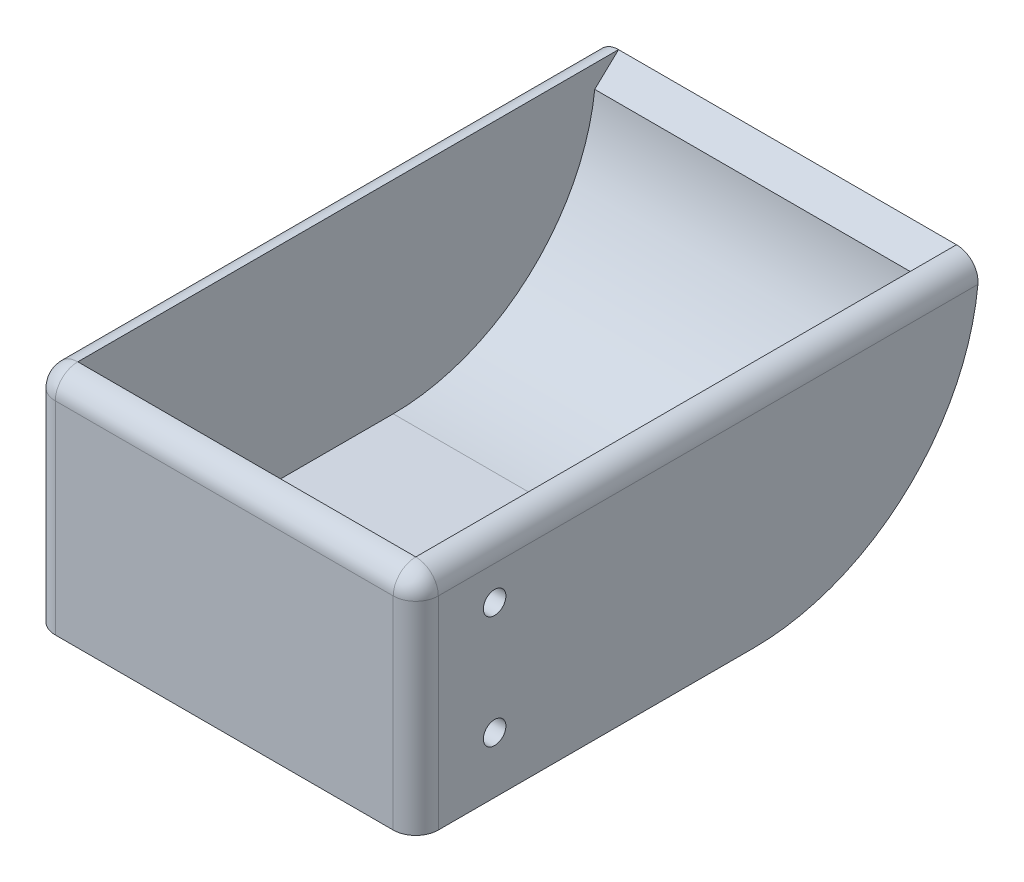
from build123d import *

# Parameters (mm, degrees)
BOSS_EXTRUDE2_DEPTH = 38.1
BOSS_EXTRUDE3_DEPTH = 2.54
BOSS_EXTRUDE5_START = 2.54
BOSS_EXTRUDE5_DEPTH = 2.54
FILLET1_R           = 2.54
FILLET3_R           = 2.54
FILLET5_R           = 2.54
SKETCH5_R           = 1.27
CUT_EXTRUDE1_DEPTH  = 2.54


with BuildPart() as part:
    # Sketch1 → Boss-Extrude2 (new body)
    with BuildSketch(Plane(origin=(0, 0, 0), x_dir=(0, 0, -1), z_dir=(1, 0, 0))):
        with BuildLine():
            Line((-60.96, 0), (-63.5, 0))
            Line((-63.5, 0), (-63.5, -25.4))
            Line((-63.5, -25.4), (-25.4, -25.4))
            ThreePointArc((-25.4, -25.4), (-7.439487758, -17.960512242), (0, 0))
            Line((0, 0), (-2.681549349, -2.54))
            ThreePointArc((-2.681549349, -2.54), (-10.16, -17.038837989), (-25.4, -22.86))
            Line((-25.4, -22.86), (-60.96, -22.86))
            Line((-60.96, -22.86), (-60.96, 0))
        make_face()
    extrude(amount=BOSS_EXTRUDE2_DEPTH)

    # Sketch2 → Boss-Extrude3 (add)
    with BuildSketch(Plane(origin=(38.1, 0, 0), x_dir=(0, 0, -1), z_dir=(1, 0, 0))):
        with BuildLine():
            Line((-63.5, 0), (0, 0))
            ThreePointArc((0, 0), (-7.439487758, -17.960512242), (-25.4, -25.4))
            Line((-25.4, -25.4), (-63.5, -25.4))
            Line((-63.5, -25.4), (-63.5, 0))
        make_face()
    extrude(amount=BOSS_EXTRUDE3_DEPTH)

    # Sketch3 → Boss-Extrude5 (add)
    with BuildSketch(Plane.ZY.offset(BOSS_EXTRUDE5_START)):
        with BuildLine():
            Line((2.681549349, -2.54), (0, 0))
            ThreePointArc((0, 0), (7.439487758, -17.960512242), (25.4, -25.4))
            Line((25.4, -25.4), (63.5, -25.4))
            Line((63.5, -25.4), (63.5, 0))
            Line((63.5, 0), (60.96, 0))
            Line((60.96, 0), (60.96, -22.86))
            Line((60.96, -22.86), (25.4, -22.86))
            ThreePointArc((25.4, -22.86), (10.16, -17.038837989), (2.681549349, -2.54))
        make_face()
        with BuildLine():
            Line((60.96, 0), (0, 0))
            Line((0, 0), (2.681549349, -2.54))
            ThreePointArc((2.681549349, -2.54), (10.16, -17.038837989), (25.4, -22.86))
            Line((25.4, -22.86), (60.96, -22.86))
            Line((60.96, -22.86), (60.96, 0))
        make_face()
    extrude(amount=-BOSS_EXTRUDE5_DEPTH)

    # Fillet1
    fillet1_edges = [part.edges().sort_by_distance(p)[0] for p in [
        (40.64, 0, 31.75),
    ]]
    fillet(fillet1_edges, radius=FILLET1_R - 0.0001)  # a hair under: the kernel refuses the full size

    # Fillet3
    fillet3_edges = [part.edges().sort_by_distance(p)[0] for p in [
        (-2.54, 0, 31.75),
    ]]
    fillet(fillet3_edges, radius=FILLET3_R - 0.0001)  # a hair under: the kernel refuses the full size

    # Fillet5
    fillet5_edges = [part.edges().sort_by_distance(p)[0] for p in [
        (40.64, -13.96995, 63.5),
        (39.896080514, -0.743919486, 63.5),
        (-2.54, -13.96995, 63.5),
        (-1.796080514, -0.743919486, 63.5),
        (19.05, 0, 63.5),
    ]]
    fillet(fillet5_edges, radius=FILLET5_R - 0.0001)  # a hair under: the kernel refuses the full size

    # Sketch5 → Cut-Extrude1 (cut)
    with BuildSketch(Plane(origin=(40.64, 0, 0), x_dir=(0, 0, -1), z_dir=(1, 0, 0))):
        with Locations((-54.61, -6.35)):
            Circle(SKETCH5_R)
        with Locations((-54.61, -19.05)):
            Circle(SKETCH5_R)
    extrude(amount=-CUT_EXTRUDE1_DEPTH, mode=Mode.SUBTRACT)


solid = part.part
